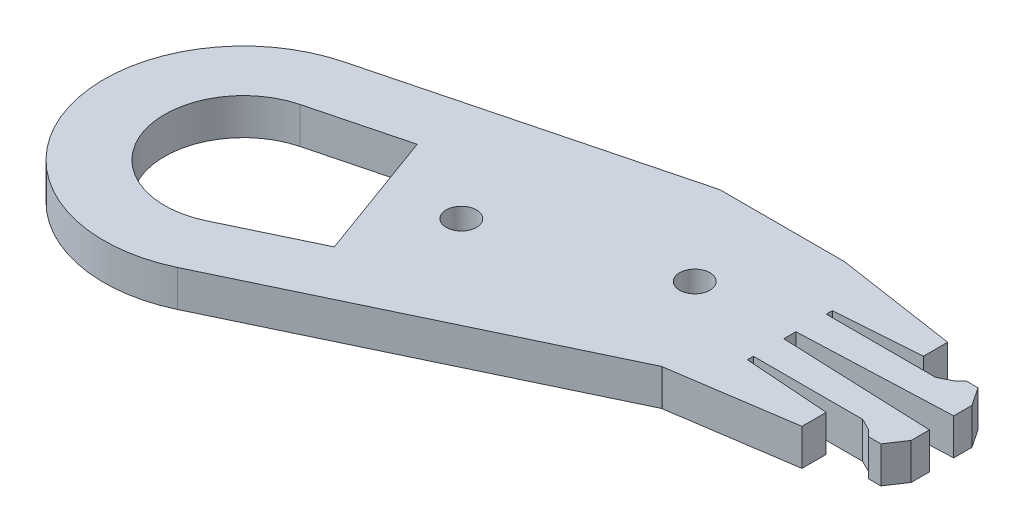
from build123d import *

# Parameters (mm, degrees)
SKETCH4_R           = 1.25
BOSS_EXTRUDE2_DEPTH = 3


with BuildPart() as part:
    # Sketch4 → Boss-Extrude2 (new body)
    with BuildSketch(Plane(origin=(0, 0, 0), x_dir=(1, 0, 0), z_dir=(0, 1, 0))):
        with BuildLine():
            Line((21.737293787, 17.5), (0, 11.87835359))
            Line((0, 11.87835359), (-2.879370047, 11.133697864))
            ThreePointArc((-2.879370047, 11.133697864), (-10.806465139, -3.933231648), (4.950877613, -10.37973077))
            Line((4.950877613, -10.37973077), (31.953794717, 2.5))
            Line((31.953794717, 2.5), (32, 2.5))
            Line((32, 2.5), (42, 4))
            Line((42, 4), (42, 6))
            Line((42, 6), (35, 6.5))
            Line((35, 6.5), (35, 7))
            Line((35, 7), (44, 7))
            Line((44, 7), (45, 6.5))
            Line((45, 6.5), (45.5, 6))
            Line((45.5, 6), (46.5, 6))
            Line((46.5, 6), (47.5, 7.5))
            Line((47.5, 7.5), (47.5, 9))
            Line((47.5, 9), (35, 9.5))
            Line((35, 9.5), (35, 10.5))
            Line((35, 10.5), (47.5, 11))
            Line((47.5, 11), (47.5, 12.5))
            Line((47.5, 12.5), (46.5, 14))
            Line((46.5, 14), (45.5, 14))
            Line((45.5, 14), (45, 13.5))
            Line((45, 13.5), (44, 13))
            Line((44, 13), (35, 13))
            Line((35, 13), (35, 13.5))
            Line((35, 13.5), (42, 14))
            Line((42, 14), (42, 16))
            Line((42, 16), (32, 17.5))
            Line((32, 17.5), (21.737293787, 17.5))
        make_face()
        with BuildLine():
            Line((-1.627470026, 6.292959662), (0, 6.713852029))
            Line((0, 6.713852029), (6.033902904, 8.274325422))
            Line((6.033902904, 8.274325422), (9.94087165, -2.459982986))
            Line((9.94087165, -2.459982986), (2.798322129, -5.866804348))
            ThreePointArc((2.798322129, -5.866804348), (-6.108002035, -2.223130932), (-1.627470026, 6.292959662))
        make_face(mode=Mode.SUBTRACT)
        with Locations((13.155696691, 4.788282007)):
            Circle(SKETCH4_R, mode=Mode.SUBTRACT)
        with Locations((27.251086003, 9.918584156)):
            Circle(SKETCH4_R, mode=Mode.SUBTRACT)
    extrude(amount=-BOSS_EXTRUDE2_DEPTH)


solid = part.part
